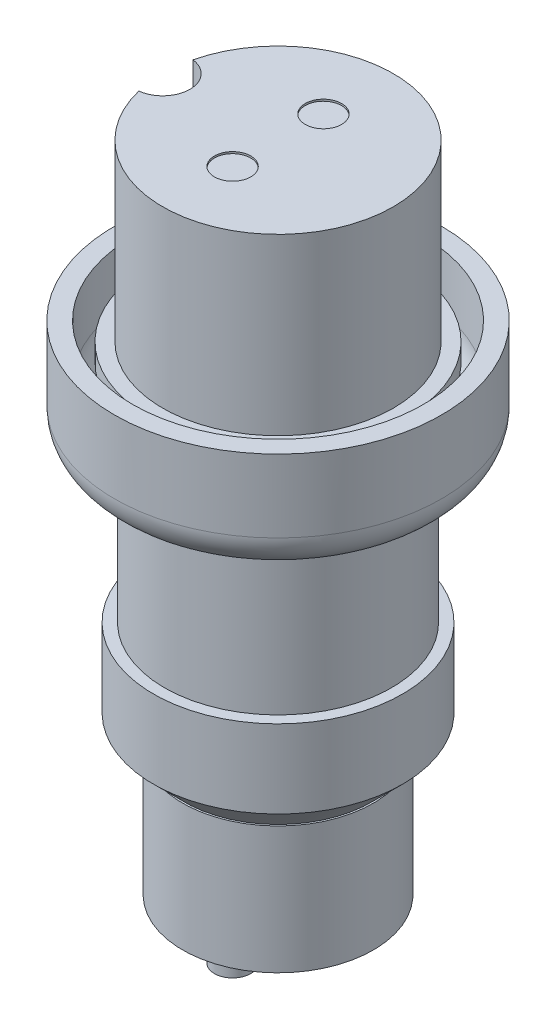
from build123d import *

# Parameters (mm, degrees)
SKETCH_1_R          = 6.35
EXTRUDE_1_DEPTH     = 9.6
SKETCH_2_R          = 7.125
EXTRUDE_2_DEPTH     = 1
SKETCH_3_R          = 6.25
EXTRUDE_3_DEPTH     = 12.38
SKETCH_4_R          = 6.85
EXTRUDE_4_DEPTH     = 6
CHAMFER_1_SIZE      = 1.7
SKETCH_5_R          = 5.25
EXTRUDE_5_DEPTH     = 7
SKETCH_6_R          = 9
EXTRUDE_6_DEPTH     = 1
SKETCH_7_R          = 9
SKETCH_7_R_2        = 8
EXTRUDE_7_DEPTH     = 5
FILLET_1_R          = 2
SKETCH_8_R          = 1
EXTRUDE_8_DEPTH     = 2
SKETCH_9_R          = 1.5
CUT_EXTRUDE_1_DEPTH = 9.6
SKETCH_10_R         = 1
CUT_EXTRUDE_2_DEPTH = 0.1


with BuildPart() as part:
    # 草图1 → 凸台-拉伸1 (new body)
    with BuildSketch(Plane(origin=(0, 0, 0), x_dir=(1, 0, 0), z_dir=(0, 1, 0))):
        with Locations(Location((0, 0, 0), (0, 0, 270))):
            Circle(SKETCH_1_R)
    extrude(amount=EXTRUDE_1_DEPTH)

    # 草图2 → 凸台-拉伸2 (add)
    with BuildSketch(Plane(origin=(0, 0, 0), x_dir=(-1, 0, 0), z_dir=(0, -1, 0))):
        with Locations(Location((0, 0, 0), (0, 0, 90))):
            Circle(SKETCH_2_R)
    extrude(amount=EXTRUDE_2_DEPTH)

    # 草图3 → 凸台-拉伸3 (add)
    with BuildSketch(Plane.XZ.offset(1)):
        with Locations(Location((0, 0, 0), (0, 0, 270))):
            Circle(SKETCH_3_R)
    extrude(amount=EXTRUDE_3_DEPTH)

    # 草图4 → 凸台-拉伸4 (add)
    with BuildSketch(Plane.XZ.offset(13.38)):
        with Locations(Location((0, 0, 0), (0, 0, 270))):
            Circle(SKETCH_4_R)
    extrude(amount=EXTRUDE_4_DEPTH)

    # 倒角1
    chamfer_1_edges = [part.edges().sort_by_distance(p)[0] for p in [
        (0, -19.38, 6.85),
    ]]
    chamfer(chamfer_1_edges, length=CHAMFER_1_SIZE)

    # 草图5 → 凸台-拉伸5 (add)
    with BuildSketch(Plane.XZ.offset(19.38)):
        with Locations(Location((0, 0, 0), (0, 0, 270))):
            Circle(SKETCH_5_R)
    extrude(amount=EXTRUDE_5_DEPTH)

    # 草图6 → 凸台-拉伸6 (add)
    with BuildSketch(Plane(origin=(0, -5, 0), x_dir=(-1, 0, 0), z_dir=(0, -1, 0))):
        with Locations(Location((0, 0, 0), (0, 0, 90))):
            Circle(SKETCH_6_R)
    extrude(amount=-EXTRUDE_6_DEPTH)

    # 草图7 → 凸台-拉伸7 (add)
    with BuildSketch(Plane(origin=(0, -4, 0), x_dir=(1, 0, 0), z_dir=(0, 1, 0))):
        with Locations(Location((0, 0, 0), (0, 0, 90))):
            Circle(SKETCH_7_R)
        with Locations(Location((0, 0, 0), (0, 0, 270))):
            Circle(SKETCH_7_R_2, mode=Mode.SUBTRACT)
    extrude(amount=EXTRUDE_7_DEPTH)

    # 圆角1
    # the kernel refuses this fillet: 2 mm, written as the material it adds along each edge
    with BuildSketch(Plane(origin=(0, -4, 0), x_dir=(0, 0, 1), z_dir=(-1, 0, 0))) as fillet_1_piece_1:
        with BuildLine():
            CenterArc((6, 1.984313483), FILLET_1_R, 277.180755781, 82.819244219)
            Line((6.25, 0), (8, 0))
            Line((8, 0), (8, 1.984313483))
        make_face()
    revolve(axis=Axis((0, -4, 0), (0, 1, 0)))
    # the kernel refuses this fillet: 2 mm, written as the material it takes off along each edge
    with BuildSketch(Plane(origin=(0, -5, 0), x_dir=(0, 0, -1), z_dir=(-1, 0, 0))) as fillet_1_2_piece_1:
        with BuildLine():
            CenterArc((9 - FILLET_1_R, -FILLET_1_R), FILLET_1_R, 0, 90)
            Line((9, -FILLET_1_R), (9, 0))
            Line((9, 0), (9 - FILLET_1_R, 0))
        make_face()
    revolve(axis=Axis((0, -5, 0), (0, -1, 0)), mode=Mode.SUBTRACT)

    # 草图8 → 凸台-拉伸8 (add)
    with BuildSketch(Plane.XZ.offset(26.38)):
        with Locations(Location((0, -2.5, 0), (0, 0, 270))):
            Circle(SKETCH_8_R)
        with Locations(Location((0, 2.5, 0), (0, 0, 270))):
            Circle(SKETCH_8_R)
    extrude(amount=EXTRUDE_8_DEPTH)

    # 草图9 → 切除-拉伸1 (cut)
    with BuildSketch(Plane(origin=(0, 9.6, 0), x_dir=(1, 0, 0), z_dir=(0, 1, 0))):
        with Locations((-6.35, 0)):
            Circle(SKETCH_9_R)
    extrude(amount=-CUT_EXTRUDE_1_DEPTH, mode=Mode.SUBTRACT)

    # 草图10 → 切除-拉伸2 (cut)
    with BuildSketch(Plane(origin=(0, 9.6, 0), x_dir=(1, 0, 0), z_dir=(0, 1, 0))):
        with Locations(Location((0, -2.5, 0), (0, 0, 90))):
            Circle(SKETCH_10_R)
        with Locations(Location((0, 2.5, 0), (0, 0, 90))):
            Circle(SKETCH_10_R)
    extrude(amount=-CUT_EXTRUDE_2_DEPTH, mode=Mode.SUBTRACT)


solid = part.part
